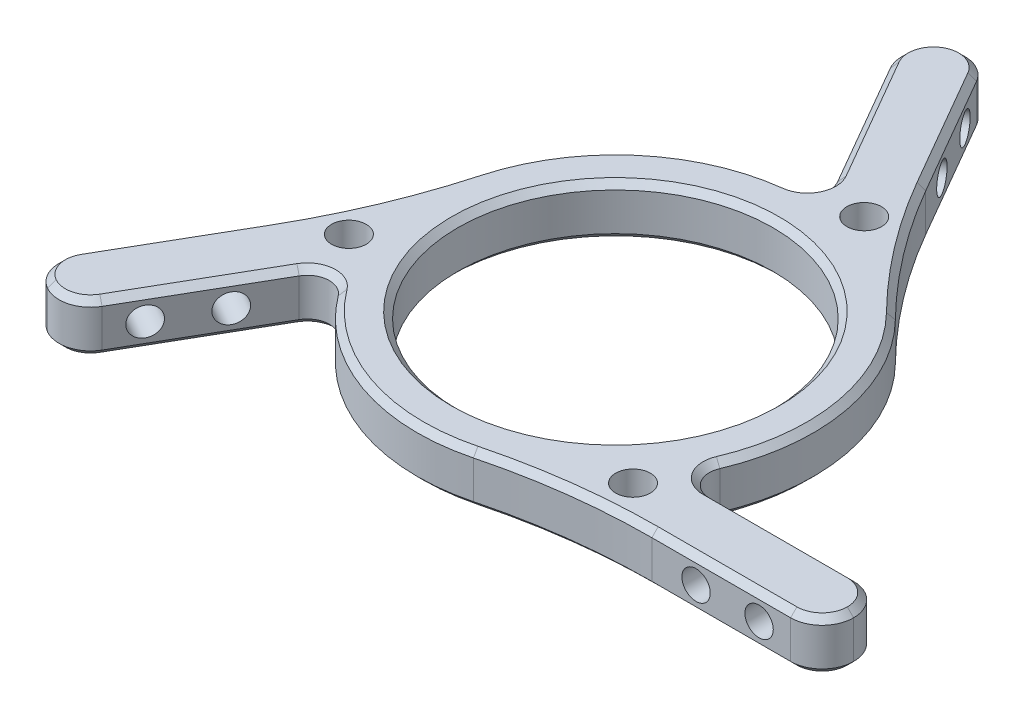
from build123d import *

# Parameters (mm, degrees)
BOSS_EXTRUDE1_DEPTH = 8
SKETCH2_R           = 2.25
CUT_EXTRUDE1_DEPTH  = 103.535212939
SKETCH4_R           = 25
SKETCH4_R_2         = 2.75
CUT_EXTRUDE2_DEPTH  = 90.231796233
FILLET1_R           = 5
FILLET2_R           = 100
FILLET3_R           = 3.5
SKETCH5_R           = 2.25
CUT_EXTRUDE3_DEPTH  = 94.342548859
SKETCH6_R           = 2.25
CUT_EXTRUDE4_DEPTH  = 87.844060995
CHAMFER1_SIZE       = 1


with BuildPart() as part:
    # Sketch1 → Boss-Extrude1 (new body)
    with BuildSketch(Plane(origin=(0, 0, 0), x_dir=(1, 0, 0), z_dir=(0, 1, 0))):
        with BuildLine():
            Line((60, -27.2), (60, -17.2))
            Line((60, -17.2), (26.27952308, -17.2))
            ThreePointArc((26.27952308, -17.2), (30.553109939, 7.277417565), (15.703927322, 27.2))
            Line((15.703927322, 27.2), (-6.444109017, 65.561524227))
            Line((-6.444109017, 65.561524227), (-15.104363055, 60.561524227))
            Line((-15.104363055, 60.561524227), (1.755875405, 31.358734587))
            ThreePointArc((1.755875405, 31.358734587), (-21.578983454, 22.821060589), (-31.407854644, 0))
            Line((-31.407854644, 0), (-53.555890983, -38.361524227))
            Line((-53.555890983, -38.361524227), (-44.895636945, -43.361524227))
            Line((-44.895636945, -43.361524227), (-28.035398485, -14.158734587))
            ThreePointArc((-28.035398485, -14.158734587), (-8.974126484, -30.098478154), (15.703927322, -27.2))
            Line((15.703927322, -27.2), (60, -27.2))
        make_face()
    extrude(amount=BOSS_EXTRUDE1_DEPTH)

    # Sketch2 → Cut-Extrude1 (cut, through all)
    with BuildSketch(Plane(origin=(0, 0, 17.2), x_dir=(-1, 0, 0), z_dir=(0, 0, -1))):
        with Locations((-50, 4)):
            Circle(SKETCH2_R)
        with Locations((-40, 4)):
            Circle(SKETCH2_R)
    extrude(amount=-CUT_EXTRUDE1_DEPTH, mode=Mode.SUBTRACT)

    # Sketch4 → Cut-Extrude2 (cut, through all)
    with BuildSketch(Plane(origin=(0, 8, 0), x_dir=(1, 0, 0), z_dir=(0, 1, 0))):
        with Locations(Location((0, 0, 0), (0, 0, 270))):
            Circle(SKETCH4_R)
        with Locations(Location((25, -22.2, 0), (0, 0, 270))):
            Circle(SKETCH4_R_2)
        with Locations(Location((-31.725763964, -10.550635095, 0), (0, 0, 270))):
            Circle(SKETCH4_R_2)
        with Locations(Location((6.725763964, 32.750635095, 0), (0, 0, 270))):
            Circle(SKETCH4_R_2)
    extrude(amount=-CUT_EXTRUDE2_DEPTH, mode=Mode.SUBTRACT)

    # Fillet1
    fillet1_edges = [part.edges().sort_by_distance(p)[0] for p in [
        (-6.444109017, 4, -65.561524227),
        (-15.104363055, 4, -60.561524227),
        (-53.555890983, 4, 38.361524227),
        (-44.895636945, 4, 43.361524227),
        (60, 4, 17.2),
        (60, 4, 27.2),
    ]]
    fillet(fillet1_edges, radius=FILLET1_R - 0.0001)  # a hair under: the kernel refuses the full size

    # Fillet2
    fillet2_edges = [part.edges().sort_by_distance(p)[0] for p in [
        (15.703927322, 4, 27.2),
        (-31.407854644, 4, 0),
        (15.703927322, 4, -27.2),
    ]]
    fillet(fillet2_edges, radius=FILLET2_R)

    # Fillet3
    fillet3_edges = [part.edges().sort_by_distance(p)[0] for p in [
        (26.27952308, 4, 17.2),
        (-28.035398485, 4, 14.158734587),
        (1.755875405, 4, -31.358734587),
    ]]
    fillet(fillet3_edges, radius=FILLET3_R)

    # Sketch5 → Cut-Extrude3 (cut, through all)
    with BuildSketch(Plane(origin=(-14.895636945, 0, -8.6), x_dir=(0.49999999999999967, 0, -0.8660254037844388), z_dir=(0.8660254037844388, 0, 0.49999999999999967))):
        with Locations((-50, 4)):
            Circle(SKETCH5_R)
        with Locations((-40, 4)):
            Circle(SKETCH5_R)
    extrude(amount=-CUT_EXTRUDE3_DEPTH, mode=Mode.SUBTRACT)

    # Sketch6 → Cut-Extrude4 (cut, through all)
    with BuildSketch(Plane(origin=(14.895636945, 0, -8.6), x_dir=(0.5000000000000007, 0, 0.8660254037844384), z_dir=(-0.8660254037844383, 0, 0.5000000000000006))):
        with Locations((-50, 4)):
            Circle(SKETCH6_R)
        with Locations((-40, 4)):
            Circle(SKETCH6_R)
    extrude(amount=-CUT_EXTRUDE4_DEPTH, mode=Mode.SUBTRACT)

    # Chamfer1
    chamfer1_edges = [part.edges().sort_by_distance(p)[0] for p in [
        (14.084814681, 0, -31.611912354),
        (14.084814681, 8, -31.611912354),
        (-34.419126501, 0, 3.608148855),
        (-34.419126501, 8, 3.608148855),
        (20.33431182, 0, 28.003763498),
        (20.33431182, 8, 28.003763498),
        (-20.487421356, 0, -23.805858513),
        (-20.487421356, 8, -23.805858513),
        (-10.372767553, 0, 29.645556608),
        (-10.372767553, 8, 29.645556608),
        (30.860188909, 0, -5.839698096),
        (30.860188909, 8, -5.839698096),
        (-1.058220823, 0, -33.090959821),
        (-1.058220823, 8, -33.090959821),
        (-28.128501429, 0, 17.461926027),
        (-28.128501429, 8, 17.461926027),
        (29.186722253, 0, 15.629033795),
        (29.186722253, 8, 15.629033795),
        (0, 0, -25),
        (0, 8, -25),
        (1.558956478, 0, -51.699808173),
        (43.553619041, 0, 17.2),
        (43.99386901, 0, 27.2),
        (-36.672446466, 0, 29.118540516),
        (-45.552825488, 0, 24.499808173),
        (-6.881172576, 0, -46.318540516),
        (58.535563195, 0, 25.735563195),
        (58.535563195, 0, 18.664436805),
        (-45.431658018, 0, 41.36106635),
        (-51.555433105, 0, 37.825503154),
        (-13.103905177, 0, -60.025503154),
        (-6.98013009, 0, -63.56106635),
        (1.558956478, 8, -51.699808173),
        (-6.881172576, 8, -46.318540516),
        (-45.552825488, 8, 24.499808173),
        (-36.672446466, 8, 29.118540516),
        (43.99386901, 8, 27.2),
        (43.553619041, 8, 17.2),
        (58.535563195, 8, 25.735563195),
        (58.535563195, 8, 18.664436805),
        (-45.431658018, 8, 41.36106635),
        (-51.555433105, 8, 37.825503154),
        (-13.103905177, 8, -60.025503154),
        (-6.98013009, 8, -63.56106635),
    ]]
    chamfer(chamfer1_edges, length=CHAMFER1_SIZE)


solid = part.part
